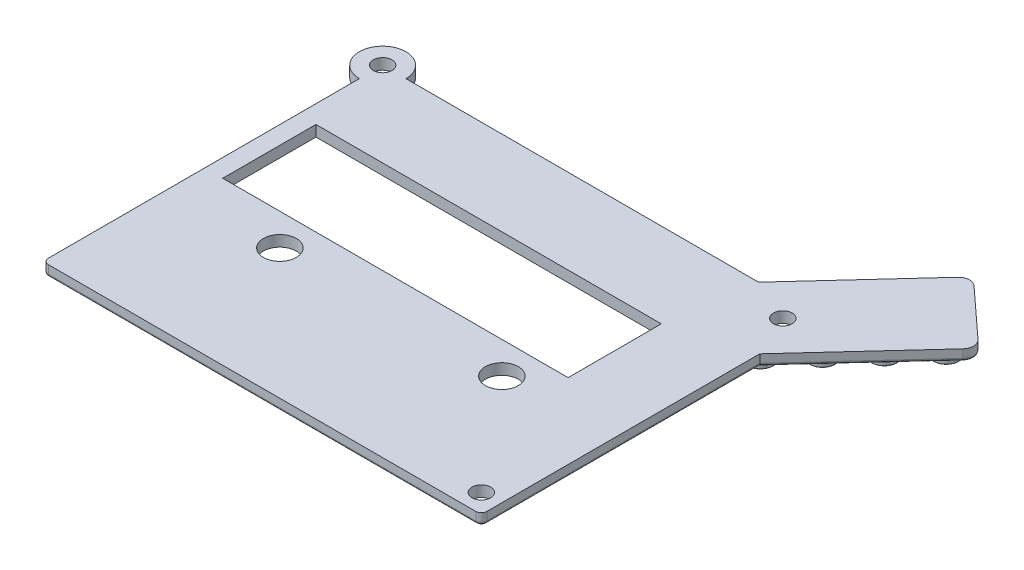
from build123d import *

# Parameters (mm, degrees)
MAIN_BODY_DEPTH        = 2
CORNERS_R              = 1
EDGE_2_R               = 0.5
DIVINGBOARD_DEPTH      = 2
FILLET5_R              = 0.5
LID_HOLES_DEPTH        = 78.216889535
LID_HOLES_DEPTH_BACK   = 78.216889535
SKETCH7_R              = 1.7
SKETCH4_R              = 2.325
BOSS_EXTRUDE3_DEPTH    = 1.6
FILLET3_R              = 0.05
LPATTERN5_COUNT        = 4
LPATTERN5_PITCH        = 8
FILLET3_OF_LPATTERN5_R = 0.05
SKETCH9_R              = 2.325
PEGS_DIAGONAL_DEPTH    = 1.6
FILLET6_R              = 0.05
LPATTERN7_COUNT        = 4
LPATTERN7_PITCH        = 8
FILLET6_OF_LPATTERN7_R = 0.05
SKETCH6_R              = 3
SKETCH6_W              = 63
SKETCH6_H              = 17
SCREEN_LED_HOLES_DEPTH = 2


# Read off the part's stored shape, not the designer's step: LPattern6
with BuildPart() as part:
    # Sketch1 → Main Body (new body)
    with BuildSketch(Plane(origin=(0, 0, 0), x_dir=(1, 0, 0), z_dir=(0, 1, 0))):
        with BuildLine():
            Line((-40, -31), (40, -31))
            Line((40, -31), (40, 31))
            Line((40, 31), (-35.75, 31))
            ThreePointArc((-35.75, 31), (-43.00520382, 34.00520382), (-40, 26.75))
            Line((-40, 26.75), (-40, -31))
        make_face()
    extrude(amount=MAIN_BODY_DEPTH)

    # Corners
    corners_edges = [part.edges().sort_by_distance(p)[0] for p in [
        (40, 1, 31),
        (-40, 1, 31),
        (40, 1, -31),
    ]]
    fillet(corners_edges, radius=CORNERS_R)

    # Edge 2
    edge_2_edges = [part.edges().sort_by_distance(p)[0] for p in [
        (0, 0, 31),
        (40, 0, 0),
        (1.625, 0, -31),
        (39.707106781, 0, 30.707106781),
        (39.707106781, 0, -30.707106781),
        (-39.707106781, 0, 30.707106781),
        (-40, 0, 1.625),
    ]]
    fillet(edge_2_edges, radius=EDGE_2_R)

    # Sketch8 → DivingBoard (add)
    with BuildSketch(Plane(origin=(0, 2, 0), x_dir=(1, 0, 0), z_dir=(0, 1, 0))):
        with BuildLine():
            Line((28.566143568, 31), (45.971638844, 49.96151786))
            ThreePointArc((45.971638844, 49.96151786), (47.359518755, 50.60722298), (48.797480521, 50.082426152))
            Line((48.797480521, 50.082426152), (57.637730431, 41.967625999))
            ThreePointArc((57.637730431, 41.967625999), (58.283435551, 40.579746087), (57.758638723, 39.141784321))
            Line((57.758638723, 39.141784321), (40, 19.795552572))
            Line((40, 19.795552572), (28.566143568, 31))
        make_face()
    extrude(amount=-DIVINGBOARD_DEPTH)

    # Fillet5
    fillet5_edges = [part.edges().sort_by_distance(p)[0] for p in [
        (47.359518755, 0, -50.60722298),
        (58.283435551, 0, -40.579746087),
        (37.268891206, 0, -40.48075893),
        (48.879319362, 0, -29.468668447),
        (53.217605476, 0, -46.025026075),
    ]]
    fillet(fillet5_edges, radius=FILLET5_R)

    # Sketch7 → Lid Holes (cut, two sides: drawn at the far end of the back side and taken through both)
    with BuildSketch(Plane(origin=(0, 0, 0), x_dir=(-1, 0, 0), z_dir=(0, -1, 0)).offset(-LID_HOLES_DEPTH_BACK)):
        with Locations(Location((-36.5, 27.5, 0), (0, 0, 90))):
            Circle(SKETCH7_R)
        with Locations(Location((-36.5, -27.5, 0), (0, 0, 90))):
            Circle(SKETCH7_R)
        with Locations(Location((40, 31, 0), (0, 0, 90))):
            Circle(SKETCH7_R)
    extrude(amount=LID_HOLES_DEPTH + LID_HOLES_DEPTH_BACK, mode=Mode.SUBTRACT)

    # Sketch4 → Boss-Extrude3 (add)
    with BuildSketch(Plane(origin=(0, 0, 0), x_dir=(-1, 0, 0), z_dir=(0, -1, 0))):
        with Locations(Location((-21.5, -24, 0), (0, 0, 270))):
            Circle(SKETCH4_R)
    boss_extrude3 = extrude(amount=BOSS_EXTRUDE3_DEPTH)

    # Fillet3
    fillet3_edges = [part.edges().sort_by_distance(p)[0] for p in [
        (21.5, -1.6, 21.675),
    ]]
    fillet(fillet3_edges, radius=FILLET3_R)

    # LPattern5: Boss-Extrude3 ×4
    with Locations(*[(-i * LPATTERN5_PITCH, 0, 0) for i in range(1, LPATTERN5_COUNT)]):
        add(boss_extrude3)

    # Fillet3 of LPattern5
    fillet3_of_lpattern5_edges = [part.edges().sort_by_distance(p)[0] for p in [
        (13.5, -1.6, 21.675),
        (5.5, -1.6, 21.675),
        (-2.5, -1.6, 21.675),
    ]]
    fillet(fillet3_of_lpattern5_edges, radius=FILLET3_OF_LPATTERN5_R)

    # LPattern6 outline → LPattern6 (revolve)
    with BuildSketch(Plane(origin=(21.5, 0, 16), x_dir=(1, 0, 0), z_dir=(0, 0, 1))):
        with BuildLine():
            Line((0, 0), (0, -1.6))
            Line((0, -1.6), (2.275, -1.6))
            ThreePointArc((2.275, -1.6), (2.310355339, -1.585355339), (2.325, -1.55))
            Line((2.325, -1.55), (2.325, 0))
            Line((2.325, 0), (0, 0))
        make_face()
    revolve(axis=Axis((21.5, 0, 16), (0, 1, 0)))

    # LPattern6 2 outline → LPattern6 2 (revolve)
    with BuildSketch(Plane(origin=(13.5, 0, 16), x_dir=(1, 0, 0), z_dir=(0, 0, 1))):
        with BuildLine():
            Line((0, 0), (0, -1.6))
            Line((0, -1.6), (2.275, -1.6))
            ThreePointArc((2.275, -1.6), (2.310355339, -1.585355339), (2.325, -1.55))
            Line((2.325, -1.55), (2.325, 0))
            Line((2.325, 0), (0, 0))
        make_face()
    revolve(axis=Axis((13.5, 0, 16), (0, 1, 0)))

    # LPattern6 3 outline → LPattern6 3 (revolve)
    with BuildSketch(Plane(origin=(5.5, 0, 16), x_dir=(1, 0, 0), z_dir=(0, 0, 1))):
        with BuildLine():
            Line((0, 0), (0, -1.6))
            Line((0, -1.6), (2.275, -1.6))
            ThreePointArc((2.275, -1.6), (2.310355339, -1.585355339), (2.325, -1.55))
            Line((2.325, -1.55), (2.325, 0))
            Line((2.325, 0), (0, 0))
        make_face()
    revolve(axis=Axis((5.5, 0, 16), (0, 1, 0)))

    # LPattern6 4 outline → LPattern6 4 (revolve)
    with BuildSketch(Plane(origin=(-2.5, 0, 16), x_dir=(1, 0, 0), z_dir=(0, 0, 1))):
        with BuildLine():
            Line((0, 0), (0, -1.6))
            Line((0, -1.6), (2.275, -1.6))
            ThreePointArc((2.275, -1.6), (2.310355339, -1.585355339), (2.325, -1.55))
            Line((2.325, -1.55), (2.325, 0))
            Line((2.325, 0), (0, 0))
        make_face()
    revolve(axis=Axis((-2.5, 0, 16), (0, 1, 0)))

    # Sketch9 → Pegs (Diagonal) (add)
    with BuildSketch(Plane(origin=(0, 0, 0), x_dir=(-1, 0, 0), z_dir=(0, -1, 0))):
        with Locations(Location((-47.565922121, 45.78320949, 0), (0, 0, 270))):
            Circle(SKETCH9_R)
        with Locations(Location((-53.459422061, 40.373342721, 0), (0, 0, 270))):
            Circle(SKETCH9_R)
    pegs_diagonal = extrude(amount=PEGS_DIAGONAL_DEPTH)

    # Fillet6
    fillet6_edges = [part.edges().sort_by_distance(p)[0] for p in [
        (47.565922121, -1.6, -48.10820949),
        (53.459422061, -1.6, -42.698342721),
    ]]
    fillet(fillet6_edges, radius=FILLET6_R)

    # LPattern7: Pegs (Diagonal) ×4
    with Locations(*[Vector(-0.6762333461397131, 0, 0.7366874924747177) * (i * LPATTERN7_PITCH) for i in range(1, LPATTERN7_COUNT)]):
        add(pegs_diagonal)

    # Fillet6 of LPattern7
    fillet6_of_lpattern7_edges = [part.edges().sort_by_distance(p)[0] for p in [
        (42.156055352, -1.6, -42.21470955),
        (48.049555292, -1.6, -36.804842781),
        (36.746188583, -1.6, -36.321209611),
        (42.639688523, -1.6, -30.911342841),
        (31.336321814, -1.6, -30.427709671),
        (37.229821754, -1.6, -25.017842902),
    ]]
    fillet(fillet6_of_lpattern7_edges, radius=FILLET6_OF_LPATTERN7_R)

    # Sketch6 → Screen & LED holes (cut)
    with BuildSketch(Plane(origin=(0, 0, 0), x_dir=(-1, 0, 0), z_dir=(0, -1, 0))):
        with Locations(Location((20.5, -7.25, 0), (0, 0, 90))):
            Circle(SKETCH6_R)
        with Locations(Location((-20, -7.25, 0), (0, 0, 90))):
            Circle(SKETCH6_R)
        with Locations((5.22, 7.05)):
            Rectangle(SKETCH6_W, SKETCH6_H)
    extrude(amount=-SCREEN_LED_HOLES_DEPTH, mode=Mode.SUBTRACT)


solid = part.part
